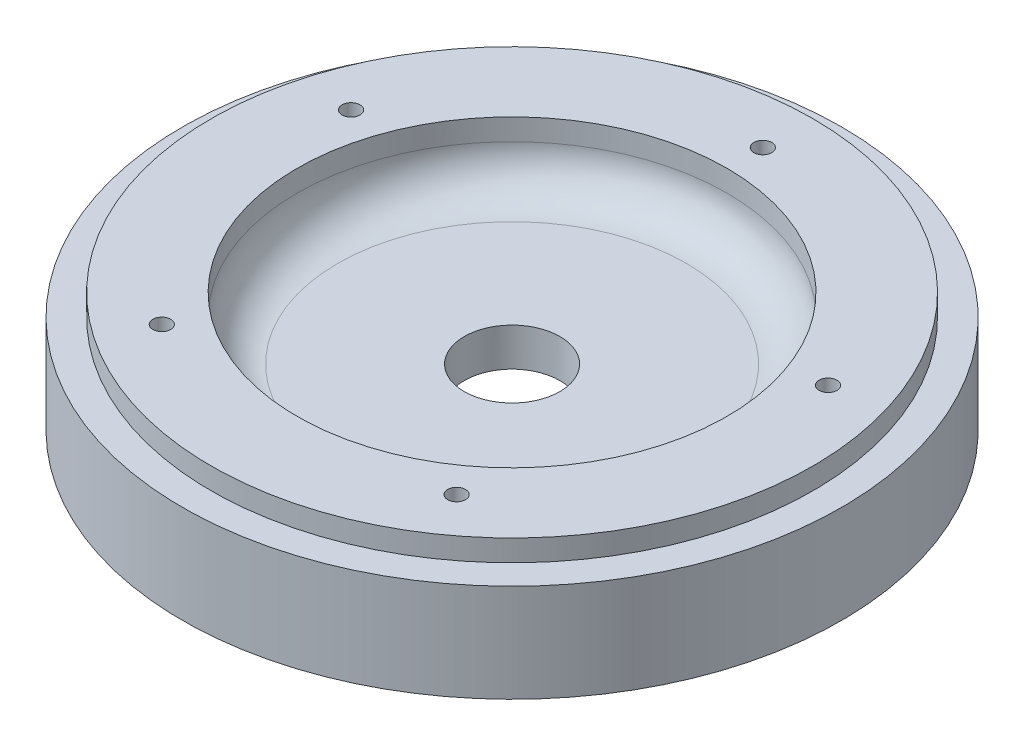
from build123d import *

# Parameters (mm, degrees)
F_1_1_DIAMETER_HOLE1_D = 25.4
CIRPATTERN1_COUNT      = 5
FILLET2_R              = 10.795


with BuildPart() as part:
    # Sketch1 → Revolve1 (revolve)
    with BuildSketch(Plane.XY, mode=Mode.PRIVATE) as revolve1_sk:
        Polygon((87.63, 0), (57.15, 0), (57.15, 5.08), (0, 5.08), (0, 15.24), (57.15, 15.24), (57.15, 31.75), (79.9973, 31.75), (79.9973, 26.035), (87.63, 26.035), align=None)
    revolve(revolve1_sk.sketch.rotate(Axis((0, 5.08, 0), (0, 1, 0)), 90), axis=Axis((0, 5.08, 0), (0, 1, 0)))

    # 1 (1) Diameter Hole1 (through all)
    with Locations(Plane(origin=(0, 15.24, 0), x_dir=(1, 0, 0), z_dir=(0, 1, 0))):
        with Locations((0, 0)):
            Hole(F_1_1_DIAMETER_HOLE1_D / 2)

    # Sketch7 → 3/16 (0.1865) Dowel Hole1 (revolve, cut)
    with BuildSketch(Plane(origin=(0, 31.75, -66.675), x_dir=(0, 0, 1), z_dir=(1, 0, 0))):
        Polygon((0, 0), (0, 14.123168419), (2.36855, 12.7), (2.36855, 0), align=None)
    f_3_16_0_1865_dowel_hole1 = revolve(axis=Axis((0, 38.1, -66.675), (0, -1, 0)), mode=Mode.SUBTRACT)

    # CirPattern1: 3/16 (0.1865) Dowel Hole1 ×5 about axis
    cirpattern1_axis = Axis((0, 0, 0), (0, 1, 0))
    for i in range(1, CIRPATTERN1_COUNT):
        add(f_3_16_0_1865_dowel_hole1.rotate(cirpattern1_axis, i * 360 / CIRPATTERN1_COUNT), mode=Mode.SUBTRACT)

    # Fillet2
    # the kernel refuses this fillet: 10.795 mm, written as the material it adds along each edge
    with BuildSketch(Plane(origin=(0, 5.08, 0), x_dir=(0, 0, -1), z_dir=(1, 0, 0))) as fillet2_piece_1:
        with BuildLine():
            CenterArc((47.99189976, -10.795), FILLET2_R, 31.965718751, 58.034281249)
            Line((47.99189976, 0), (47.99189976, 0.2159))
            Line((47.99189976, 0.2159), (57.15, 0.2159))
            Line((57.15, 0.2159), (57.3659, 0))
            ThreePointArc((57.3659, 0), (57.3659, -2.54), (57.333162005, -4.9657))
            Line((57.333162005, -4.9657), (57.15, -5.08))
        make_face()
    revolve(axis=Axis((0, 5.08, 0), (0, 1, 0)))
    with BuildSketch(Plane(origin=(0, 15.24, 0), x_dir=(0, 0, -1), z_dir=(1, 0, 0))) as fillet2_piece_2:
        with BuildLine():
            CenterArc((57.15 - FILLET2_R, FILLET2_R), FILLET2_R, 270, 90)
            Line((57.15, FILLET2_R), (57.15 + FILLET2_R * 0.02, FILLET2_R))
            Line((57.15 + FILLET2_R * 0.02, FILLET2_R), (57.15 + FILLET2_R * 0.02, -FILLET2_R * 0.02))
            Line((57.15 + FILLET2_R * 0.02, -FILLET2_R * 0.02), (57.15 - FILLET2_R, -FILLET2_R * 0.02))
            Line((57.15 - FILLET2_R, -FILLET2_R * 0.02), (57.15 - FILLET2_R, 0))
        make_face()
    revolve(axis=Axis((0, 15.24, 0), (0, 1, 0)))


solid = part.part
